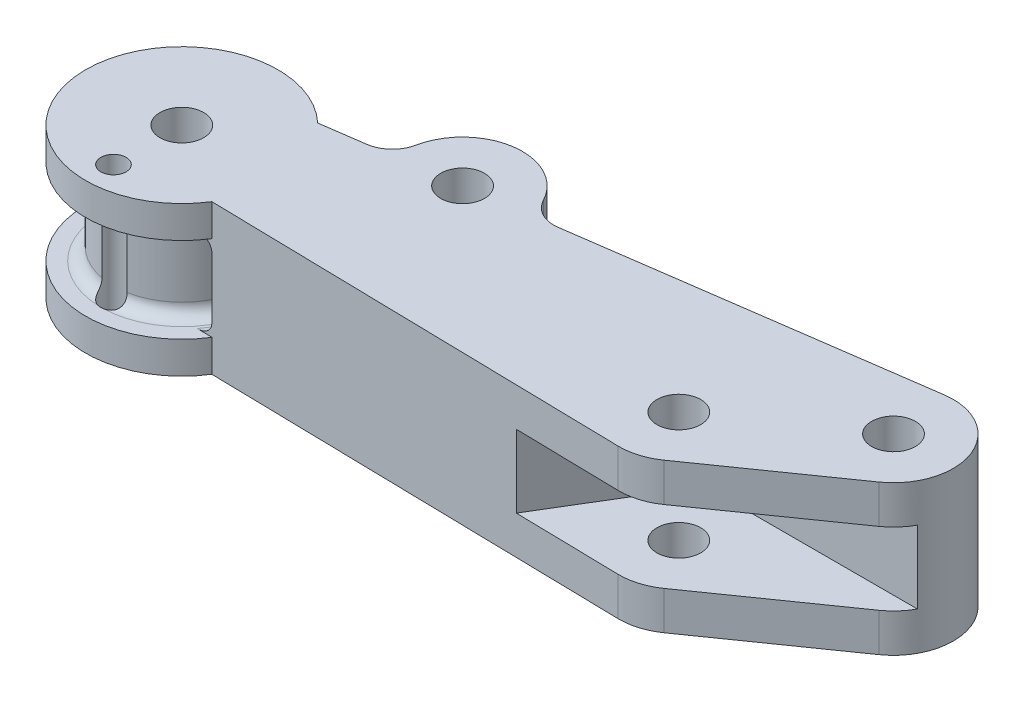
from build123d import *
from build123d.topology import SkipClean

# Parameters (mm, degrees)
SKETCH1_R           = 1.3
SKETCH1_R_2         = 0.75
SKETCH1_R_3         = 1.2999974
BOSS_EXTRUDE1_DEPTH = 8.89
SKETCH1_3_R         = 5.715
SKETCH1_3_R_2       = 4.064
CUT_EXTRUDE1_DEPTH  = 6.985
BOSS_EXTRUDE2_DEPTH = 1.905
FILLET4_R           = 0.7366
SKETCH1_5_R         = 1.2999974
CUT_EXTRUDE2_DEPTH  = 5.588
SKETCH1_6_R         = 1.2999974
BOSS_EXTRUDE3_DEPTH = 3.302
CUT_EXTRUDE3_DEPTH  = 6.604
BOSS_EXTRUDE4_DEPTH = 2.286


with BuildPart() as part:
    # Sketch1 → Boss-Extrude1 (new body)
    with BuildSketch(Plane(origin=(0, 0, 0), x_dir=(1, 0, 0), z_dir=(0, 1, 0))):
        with BuildLine():
            ThreePointArc((3.930104201, 4.14915726), (-5.670420967, -0.712426178), (4.834348043, -3.048))
            Line((4.834348043, -3.048), (29.478335544, -3.555246973))
            ThreePointArc((29.478335544, -3.555246973), (30.585869157, -3.402240978), (31.591150968, -2.912904669))
            Line((31.591150968, -2.912904669), (39.099786947, 2.344698845))
            ThreePointArc((39.099786947, 2.344698845), (40.367866174, 6.563032187), (36.560672162, 8.778350417))
            Line((36.560672162, 8.778350417), (16.46079264, 5.926845507))
            ThreePointArc((16.46079264, 5.926845507), (15.393588111, 6.106168793), (14.625236588, 6.868217534))
            ThreePointArc((14.625236588, 6.868217534), (10.975084871, 8.740211971), (7.989630154, 5.926845507))
            ThreePointArc((7.989630154, 5.926845507), (7.463549388, 4.981159844), (6.488331058, 4.512084631))
            Line((6.488331058, 4.512084631), (3.930104201, 4.14915726))
        make_face()
        with Locations(Location((0, 0, 0), (0, 0, 270))):
            Circle(SKETCH1_R, mode=Mode.SUBTRACT)
        with Locations(Location((0, -4.064, 0), (0, 0, 270))):
            Circle(SKETCH1_R_2, mode=Mode.SUBTRACT)
        with Locations(Location((29.55151316, 0, 0), (0, 0, 270))):
            Circle(SKETCH1_R, mode=Mode.SUBTRACT)
        with Locations(Location((37.060149139, 5.257603514, 0), (0, 0, 270))):
            Circle(SKETCH1_R, mode=Mode.SUBTRACT)
        with Locations(Location((11.474561849, 5.219465069, 0), (0, 0, 270))):
            Circle(SKETCH1_R_3, mode=Mode.SUBTRACT)
    extrude(amount=BOSS_EXTRUDE1_DEPTH)

    # Sketch1<3> → Cut-Extrude1 (cut)
    with BuildSketch(Plane(origin=(0, 0, 0), x_dir=(1, 0, 0), z_dir=(0, 1, 0))):
        Circle(SKETCH1_3_R)
        Circle(SKETCH1_3_R_2, mode=Mode.SUBTRACT)
    extrude(amount=CUT_EXTRUDE1_DEPTH, mode=Mode.SUBTRACT)

    # Sketch1<4> → Boss-Extrude2 (add)
    with SkipClean():  # the faces are left unmerged after this step: merging them gives an invalid solid
        with BuildSketch(Plane(origin=(0, 0, 0), x_dir=(1, 0, 0), z_dir=(0, 1, 0))):
            with BuildLine():
                Line((5.715, 0), (4.064, 0))
                ThreePointArc((4.064, 0), (3.12658698, -2.596256894), (0.746800266, -3.994794783))
                ThreePointArc((0.746800266, -3.994794783), (0.74919964, -4.029360426), (0.75, -4.064))
                ThreePointArc((0.75, -4.064), (-0.034639574, -4.81319964), (-0.746800266, -3.994794783))
                ThreePointArc((-0.746800266, -3.994794783), (-2.80994126, 2.936039188), (4.023710745, 0.570830832))
                Line((4.023710745, 0.570830832), (5.658343236, 0.802730857))
                ThreePointArc((5.658343236, 0.802730857), (5.077816803, 2.622403768), (3.930104201, 4.14915726))
                ThreePointArc((3.930104201, 4.14915726), (-5.670420967, -0.712426178), (4.834348043, -3.048))
                ThreePointArc((4.834348043, -3.048), (5.490424577, -1.586336335), (5.715, 0))
            make_face()
            with BuildLine():
                ThreePointArc((4.023710745, 0.570830832), (4.053915174, 0.286125437), (4.064, 0))
                Line((4.064, 0), (5.715, 0))
                ThreePointArc((5.715, 0), (5.700818213, 0.402363896), (5.658343236, 0.802730857))
                Line((5.658343236, 0.802730857), (4.023710745, 0.570830832))
            make_face()
        extrude(amount=BOSS_EXTRUDE2_DEPTH)

    # Fillet4
    # the kernel refuses this fillet: 0.7366 mm, written as the material it adds along each edge
    with BuildSketch(Plane(origin=(0, 6.985, 0), x_dir=(0.0031415874858795557, 0, 0.9999950652018581), z_dir=(-0.9999950652018581, 0, 0.0031415874858795557))) as fillet4_piece_1_section:
        with BuildLine():
            CenterArc((4.064 + FILLET4_R, -FILLET4_R), FILLET4_R, 90, 90)
            Line((4.064, -FILLET4_R), (4.064, 0))
            Line((4.064, 0), (4.064 + FILLET4_R, 0))
        make_face()
    fillet4_piece_1 = revolve(axis=Axis((0, 6.985, 0), (0, 1, 0)), revolution_arc=359.64, mode=Mode.PRIVATE)
    fillet4_piece_1 = fillet4_piece_1 - Plane(origin=(0, 6.77936554, 4.064), x_dir=(0, 0, 1), z_dir=(0, -1, 0)) * Cylinder(0.75, 20, mode=Mode.PRIVATE)
    add(fillet4_piece_1)
    with BuildSketch(Plane(origin=(0, 6.985, 0), x_dir=(0.6333996635082028, 0, 0.7738248291879084), z_dir=(-0.7738248291879084, 0, 0.6333996635082028))) as fillet4_piece_2_section:
        with BuildLine():
            CenterArc((5.715 - FILLET4_R, -FILLET4_R), FILLET4_R, 0, 90)
            Line((5.715 - FILLET4_R, 0), (5.715, 0))
            Line((5.715, 0), (5.715, -FILLET4_R))
        make_face()
    fillet4_piece_2 = revolve(axis=Axis((0, 6.985, 0), (0, 1, 0)), revolution_arc=115.719345032, mode=Mode.PRIVATE)
    fillet4_piece_2 = split(fillet4_piece_2, bisect_by=Plane(origin=(4.95205857, 6.776121662, -4.294138621), z_dir=(0.14046034244219252, 0, 0.9900863054305024)), keep=Keep.TOP, mode=Mode.PRIVATE)
    fillet4_piece_2 = split(fillet4_piece_2, bisect_by=Plane(origin=(5.372477219, 6.776121662, 3.059076308), z_dir=(0.020578632283041045, 0, -0.9997882375250068)), keep=Keep.TOP, mode=Mode.PRIVATE)
    add(fillet4_piece_2)
    with BuildSketch(Plane(origin=(0, 1.905, 0), x_dir=(-0.00314158748587942, 0, 0.9999950652018581), z_dir=(0.9999950652018581, 0, 0.00314158748587942))) as fillet4_piece_3_section:
        with BuildLine():
            CenterArc((4.064 + FILLET4_R, -FILLET4_R), FILLET4_R, 90, 90)
            Line((4.064, -FILLET4_R), (4.064, 0))
            Line((4.064, 0), (4.064 + FILLET4_R, 0))
        make_face()
    fillet4_piece_3 = revolve(axis=Axis((0, 1.905, 0), (0, -1, 0)), revolution_arc=359.64, mode=Mode.PRIVATE)
    fillet4_piece_3 = fillet4_piece_3 - Plane(origin=(0, 2.11063446, 4.064), x_dir=(0, 0, 1), z_dir=(0, -1, 0)) * Cylinder(0.75, 20, mode=Mode.PRIVATE)
    add(fillet4_piece_3)
    with BuildSketch(Plane(origin=(0, 1.905, 0), x_dir=(0.6333996635081833, 0, 0.7738248291879242), z_dir=(-0.7738248291879242, 0, 0.6333996635081833))) as fillet4_piece_4_section:
        with BuildLine():
            CenterArc((5.715 - FILLET4_R, FILLET4_R), FILLET4_R, 270, 90)
            Line((5.715 - FILLET4_R, 0), (5.715, 0))
            Line((5.715, 0), (5.715, FILLET4_R))
        make_face()
    fillet4_piece_4 = revolve(axis=Axis((0, 1.905, 0), (0, 1, 0)), revolution_arc=115.719345032, mode=Mode.PRIVATE)
    fillet4_piece_4 = split(fillet4_piece_4, bisect_by=Plane(origin=(4.95205857, 2.113878338, -4.294138621), z_dir=(0.14046034244219252, 0, 0.9900863054305024)), keep=Keep.TOP, mode=Mode.PRIVATE)
    fillet4_piece_4 = split(fillet4_piece_4, bisect_by=Plane(origin=(5.372477219, 2.113878338, 3.059076308), z_dir=(0.020578632283041045, 0, -0.9997882375250068)), keep=Keep.TOP, mode=Mode.PRIVATE)
    add(fillet4_piece_4)

    # Sketch1<5> → Cut-Extrude2 (cut)
    with BuildSketch(Plane(origin=(0, 0, 0), x_dir=(1, 0, 0), z_dir=(0, 1, 0))):
        with BuildLine():
            ThreePointArc((7.989630154, 5.926845507), (8.886608895, 2.780687608), (11.974038645, 1.698718141))
            ThreePointArc((11.974038645, 1.698718141), (14.159824917, 2.888264036), (15.030561849, 5.219465069))
            ThreePointArc((15.030561849, 5.219465069), (14.927744104, 6.068386923), (14.625236588, 6.868217534))
            ThreePointArc((14.625236588, 6.868217534), (10.975084871, 8.740211971), (7.989630154, 5.926845507))
        make_face()
        with Locations(Location((11.474561849, 5.219465069, 0), (0, 0, 270))):
            Circle(SKETCH1_5_R, mode=Mode.SUBTRACT)
    extrude(amount=CUT_EXTRUDE2_DEPTH, mode=Mode.SUBTRACT)

    # Sketch1<6> → Boss-Extrude3 (add)
    with BuildSketch(Plane(origin=(0, 0, 0), x_dir=(1, 0, 0), z_dir=(0, 1, 0))):
        with BuildLine():
            ThreePointArc((7.989630154, 5.926845507), (8.886608895, 2.780687608), (11.974038645, 1.698718141))
            ThreePointArc((11.974038645, 1.698718141), (14.159824917, 2.888264036), (15.030561849, 5.219465069))
            ThreePointArc((15.030561849, 5.219465069), (14.927744104, 6.068386923), (14.625236588, 6.868217534))
            ThreePointArc((14.625236588, 6.868217534), (10.975084871, 8.740211971), (7.989630154, 5.926845507))
        make_face()
        with Locations(Location((11.474561849, 5.219465069, 0), (0, 0, 270))):
            Circle(SKETCH1_6_R, mode=Mode.SUBTRACT)
    extrude(amount=BOSS_EXTRUDE3_DEPTH)

    # Sketch1<7> → Cut-Extrude3 (cut)
    with BuildSketch(Plane(origin=(0, 0, 0), x_dir=(1, 0, 0), z_dir=(0, 1, 0))):
        with BuildLine():
            Line((25.99551316, 0), (25.395135631, 0))
            Line((25.395135631, 0), (23.320467154, -3.428499623))
            Line((23.320467154, -3.428499623), (29.478335544, -3.555246973))
            ThreePointArc((29.478335544, -3.555246973), (27.011301003, -2.488465028), (25.99551316, 0))
        make_face()
        with BuildLine():
            Line((34.630007472, 3.556), (29.55151316, 3.556))
            ThreePointArc((29.55151316, 3.556), (31.193491229, 3.154210523), (32.464417829, 2.039637808))
            Line((32.464417829, 2.039637808), (34.630007472, 3.556))
        make_face()
        with BuildLine():
            ThreePointArc((26.509167773, 1.840997161), (26.12633315, 0.955655745), (25.99551316, 0))
            Line((25.99551316, 0), (28.25151316, 0))
            ThreePointArc((28.25151316, 0), (29.160595621, 1.239832036), (30.616410818, 0.745649367))
            Line((30.616410818, 0.745649367), (32.464417829, 2.039637808))
            ThreePointArc((32.464417829, 2.039637808), (31.193491229, 3.154210523), (29.55151316, 3.556))
            ThreePointArc((29.55151316, 3.556), (27.805295806, 3.097718669), (26.509167773, 1.840997161))
        make_face()
        with BuildLine():
            Line((28.25151316, 0), (25.99551316, 0))
            ThreePointArc((25.99551316, 0), (27.011301003, -2.488465028), (29.478335544, -3.555246973))
            ThreePointArc((29.478335544, -3.555246973), (30.585869157, -3.402240978), (31.591150968, -2.912904669))
            ThreePointArc((31.591150968, -2.912904669), (32.705723683, -1.641978069), (33.10751316, 0))
            ThreePointArc((33.10751316, 0), (32.942930637, 1.069309823), (32.464417829, 2.039637808))
            Line((32.464417829, 2.039637808), (30.616410818, 0.745649367))
            ThreePointArc((30.616410818, 0.745649367), (30.791345196, 0.390917539), (30.85151316, 0))
            ThreePointArc((30.85151316, 0), (29.55151316, -1.3), (28.25151316, 0))
        make_face()
        with BuildLine():
            ThreePointArc((33.10751316, 0), (32.705723683, -1.641978069), (31.591150968, -2.912904669))
            Line((31.591150968, -2.912904669), (39.099786947, 2.344698845))
            ThreePointArc((39.099786947, 2.344698845), (39.711298905, 2.887679271), (40.182597134, 3.556))
            Line((40.182597134, 3.556), (34.630007472, 3.556))
            Line((34.630007472, 3.556), (32.464417829, 2.039637808))
            ThreePointArc((32.464417829, 2.039637808), (32.942930637, 1.069309823), (33.10751316, 0))
        make_face()
        with BuildLine():
            Line((26.509167773, 1.840997161), (25.395135631, 0))
            Line((25.395135631, 0), (25.99551316, 0))
            ThreePointArc((25.99551316, 0), (26.12633315, 0.955655745), (26.509167773, 1.840997161))
        make_face()
    extrude(amount=CUT_EXTRUDE3_DEPTH, mode=Mode.SUBTRACT)

    # Sketch1<8> → Boss-Extrude4 (add)
    with BuildSketch(Plane(origin=(0, 0, 0), x_dir=(1, 0, 0), z_dir=(0, 1, 0))):
        with BuildLine():
            Line((34.630007472, 3.556), (29.55151316, 3.556))
            ThreePointArc((29.55151316, 3.556), (31.193491229, 3.154210523), (32.464417829, 2.039637808))
            Line((32.464417829, 2.039637808), (34.630007472, 3.556))
        make_face()
        with BuildLine():
            ThreePointArc((26.509167773, 1.840997161), (26.12633315, 0.955655745), (25.99551316, 0))
            Line((25.99551316, 0), (28.25151316, 0))
            ThreePointArc((28.25151316, 0), (29.160595621, 1.239832036), (30.616410818, 0.745649367))
            Line((30.616410818, 0.745649367), (32.464417829, 2.039637808))
            ThreePointArc((32.464417829, 2.039637808), (31.193491229, 3.154210523), (29.55151316, 3.556))
            ThreePointArc((29.55151316, 3.556), (27.805295806, 3.097718669), (26.509167773, 1.840997161))
        make_face()
        with BuildLine():
            Line((28.25151316, 0), (25.99551316, 0))
            ThreePointArc((25.99551316, 0), (27.011301003, -2.488465028), (29.478335544, -3.555246973))
            ThreePointArc((29.478335544, -3.555246973), (30.585869157, -3.402240978), (31.591150968, -2.912904669))
            ThreePointArc((31.591150968, -2.912904669), (32.705723683, -1.641978069), (33.10751316, 0))
            ThreePointArc((33.10751316, 0), (32.942930637, 1.069309823), (32.464417829, 2.039637808))
            Line((32.464417829, 2.039637808), (30.616410818, 0.745649367))
            ThreePointArc((30.616410818, 0.745649367), (30.791345196, 0.390917539), (30.85151316, 0))
            ThreePointArc((30.85151316, 0), (29.55151316, -1.3), (28.25151316, 0))
        make_face()
        with BuildLine():
            Line((26.509167773, 1.840997161), (25.395135631, 0))
            Line((25.395135631, 0), (25.99551316, 0))
            ThreePointArc((25.99551316, 0), (26.12633315, 0.955655745), (26.509167773, 1.840997161))
        make_face()
        with BuildLine():
            Line((25.99551316, 0), (25.395135631, 0))
            Line((25.395135631, 0), (23.320467154, -3.428499623))
            Line((23.320467154, -3.428499623), (29.478335544, -3.555246973))
            ThreePointArc((29.478335544, -3.555246973), (27.011301003, -2.488465028), (25.99551316, 0))
        make_face()
        with BuildLine():
            ThreePointArc((33.10751316, 0), (32.705723683, -1.641978069), (31.591150968, -2.912904669))
            Line((31.591150968, -2.912904669), (39.099786947, 2.344698845))
            ThreePointArc((39.099786947, 2.344698845), (39.711298905, 2.887679271), (40.182597134, 3.556))
            Line((40.182597134, 3.556), (34.630007472, 3.556))
            Line((34.630007472, 3.556), (32.464417829, 2.039637808))
            ThreePointArc((32.464417829, 2.039637808), (32.942930637, 1.069309823), (33.10751316, 0))
        make_face()
    extrude(amount=BOSS_EXTRUDE4_DEPTH)


solid = part.part
